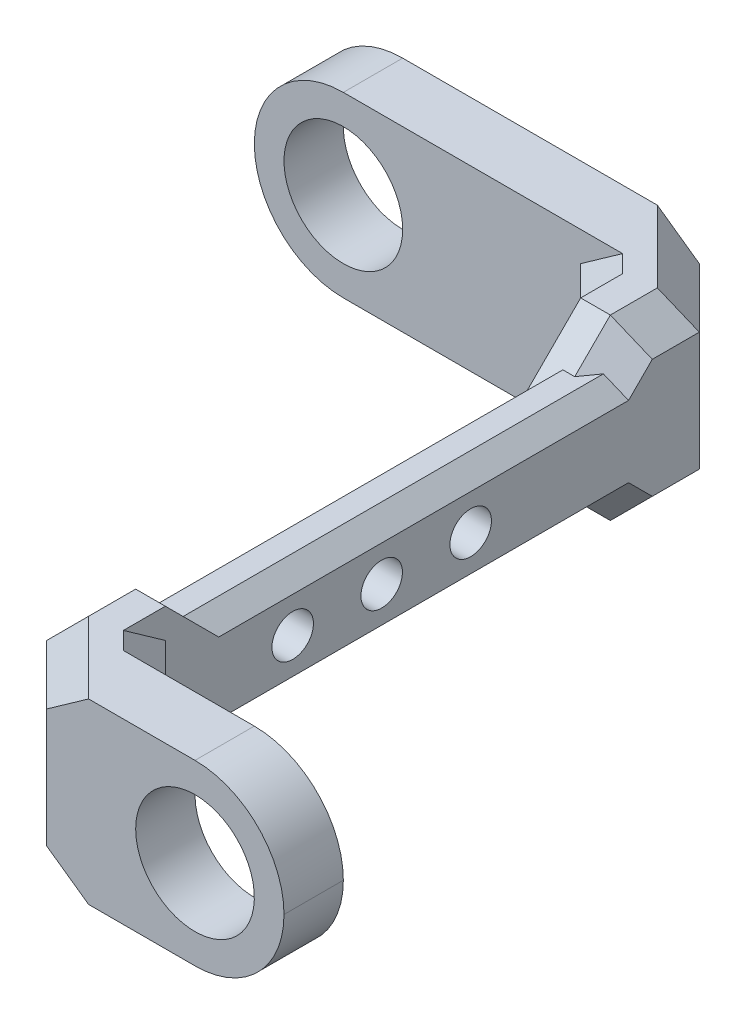
from build123d import *

# Parameters (mm, degrees)
SKETCH1_R           = 7.5
SKETCH1_R_2         = 5
BOSS_EXTRUDE1_DEPTH = 5
SKETCH2_W           = 5
SKETCH2_H           = 15
BOSS_EXTRUDE2_DEPTH = 55
SKETCH3_W           = 5
SKETCH3_H           = 15
BOSS_EXTRUDE3_DEPTH = 20
SKETCH4_R           = 5
CUT_EXTRUDE1_DEPTH  = 15
FILLET1_R           = 7.5
CHAMFER1_SIZE       = 5
CUT_EXTRUDE2_DEPTH  = 5
CHAMFER2_SIZE       = 1.5
CHAMFER3_SIZE       = 2.5
CHAMFER4_SIZE       = 2.5
SKETCH6_R           = 1.75
CUT_EXTRUDE3_DEPTH  = 10


with BuildPart() as part:
    # Sketch1 → Boss-Extrude1 (new body)
    # profile 1 of 2: a face of its own
    with BuildSketch(Plane.XY):
        Circle(SKETCH1_R)
        Circle(SKETCH1_R_2, mode=Mode.SUBTRACT)
    # profile 2 of 2: a face of its own
    with BuildSketch(Plane.XY):
        with BuildLine():
            Line((30, 7.5), (0, 7.5))
            ThreePointArc((0, 7.5), (5.303300859, 5.303300859), (7.5, 0))
            ThreePointArc((7.5, 0), (5.303300859, -5.303300859), (0, -7.5))
            Line((0, -7.5), (30, -7.5))
            Line((30, -7.5), (30, 7.5))
        make_face()
    extrude(amount=BOSS_EXTRUDE1_DEPTH)

    # Sketch2 → Boss-Extrude2 (add)
    with BuildSketch(Plane.XY.offset(5)):
        with Locations((27.5, 0)):
            Rectangle(SKETCH2_W, SKETCH2_H)
    extrude(amount=BOSS_EXTRUDE2_DEPTH)

    # Sketch3 → Boss-Extrude3 (add)
    with BuildSketch(Plane(origin=(30, 0, 0), x_dir=(0, 0, -1), z_dir=(1, 0, 0))):
        with Locations((-57.5, 0)):
            Rectangle(SKETCH3_W, SKETCH3_H)
    extrude(amount=BOSS_EXTRUDE3_DEPTH)

    # Sketch4 → Cut-Extrude1 (cut)
    with BuildSketch(Plane(origin=(0, 0, 55), x_dir=(-1, 0, 0), z_dir=(0, 0, -1))):
        with Locations(Location((-42.5, 0, 0), (0, 0, 90))):
            Circle(SKETCH4_R)
    extrude(amount=-CUT_EXTRUDE1_DEPTH, mode=Mode.SUBTRACT)

    # Fillet1
    fillet1_edges = [part.edges().sort_by_distance(p)[0] for p in [
        (50, -7.5, 57.5),
        (50, 7.5, 57.5),
    ]]
    fillet(fillet1_edges, radius=FILLET1_R - 0.0001)  # a hair under: the kernel refuses the full size

    # Chamfer1
    chamfer1_edges = [part.edges().sort_by_distance(p)[0] for p in [
        (25, 0, 5),
        (25, 0, 60),
        (30, 0, 55),
        (30, 0, 0),
    ]]
    chamfer(chamfer1_edges, length=CHAMFER1_SIZE)

    # Sketch5 → Cut-Extrude2 (cut)
    with BuildSketch(Plane.ZY.offset(-25)):
        Polygon((10, -7.5), (13, -4.5), (47, -4.5), (50, -7.5), align=None)
        Polygon((50, 7.5), (10, 7.5), (13, 4.5), (47, 4.5), align=None)
    extrude(amount=-CUT_EXTRUDE2_DEPTH, mode=Mode.SUBTRACT)

    # Chamfer2
    chamfer2_edges = [part.edges().sort_by_distance(p)[0] for p in [
        (25, -4.5, 30),
        (30, 4.5, 30),
        (25, 4.5, 30),
        (30, -4.5, 30),
    ]]
    chamfer(chamfer2_edges, length=CHAMFER2_SIZE)

    # Chamfer3
    chamfer3_edges = [part.edges().sort_by_distance(p)[0] for p in [
        (30, 5.25, 12.25),
        (25, 5.25, 47.75),
        (25, 7.5, 52.5),
        (27.5, 7.5, 57.5),
        (27.5, 7.5, 2.5),
        (25, -7.5, 52.5),
        (27.5, -7.5, 57.5),
        (27.5, -7.5, 2.5),
        (30, 7.5, 7.5),
        (30, -7.5, 7.5),
        (30, -5.25, 12.25),
        (25, -5.25, 47.75),
    ]]
    chamfer(chamfer3_edges, length=CHAMFER3_SIZE)

    # Chamfer4
    chamfer4_edges = [part.edges().sort_by_distance(p)[0] for p in [
        (22.5, -7.5, 7.5),
        (22.5, 7.5, 7.5),
        (32.5, 7.5, 52.5),
        (32.5, -7.5, 52.5),
    ]]
    chamfer(chamfer4_edges, length=CHAMFER4_SIZE)

    # Sketch6 → Cut-Extrude3 (cut)
    with BuildSketch(Plane.ZY.offset(-25)):
        with Locations((31.767766953, 0)):
            Circle(SKETCH6_R)
        with Locations((39.267766953, 0)):
            Circle(SKETCH6_R)
        with Locations((24.267766953, 0)):
            Circle(SKETCH6_R)
    extrude(amount=-CUT_EXTRUDE3_DEPTH, mode=Mode.SUBTRACT)


solid = part.part
